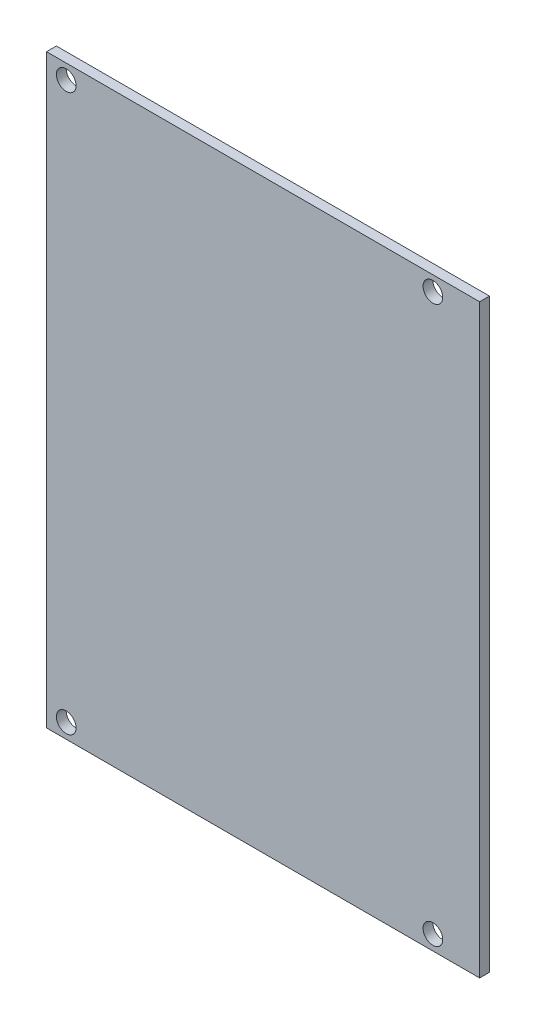
from build123d import *

# Parameters (mm, degrees)
MAIN_SKETCH_W        = 88
MAIN_SKETCH_H        = 119
MAIN_EXTRUSION_DEPTH = 2
FIX_SKETCH_R         = 2
FIX_HOLE_DEPTH       = 149.016890928


with BuildPart() as part:
    # Main-Sketch → Main-Extrusion (new body)
    with BuildSketch(Plane.XY):
        with Locations((44, 59.5)):
            Rectangle(MAIN_SKETCH_W, MAIN_SKETCH_H)
    extrude(amount=MAIN_EXTRUSION_DEPTH)

    # Fix-Sketch → Fix-Hole (cut, through all)
    with BuildSketch(Plane.XY.offset(2)):
        with Locations((4, 116)):
            Circle(FIX_SKETCH_R)
        with Locations((4, 3)):
            Circle(FIX_SKETCH_R)
        with Locations((78.5, 3)):
            Circle(FIX_SKETCH_R)
        with Locations((78.5, 116)):
            Circle(FIX_SKETCH_R)
    extrude(amount=-FIX_HOLE_DEPTH, mode=Mode.SUBTRACT)


solid = part.part
